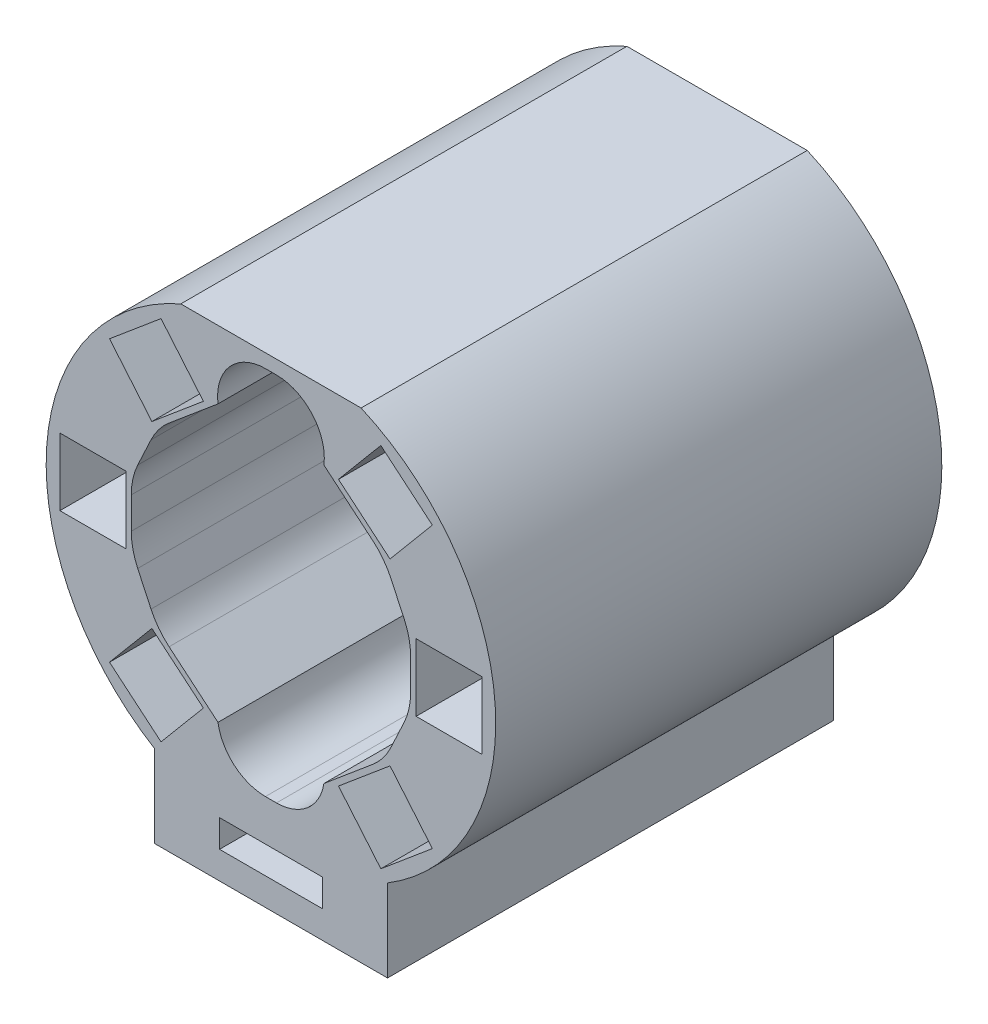
from build123d import *

# Parameters (mm, degrees)
SKETCH2_R                       = 4.79
BOSS_EXTRUDE2_DEPTH             = 65
SHELL4_START                    = 5
SHELL4_OUTLINE_R                = 4.79
SHELL4_DEPTH                    = 60
SKETCH3_W                       = 33.974254958
SKETCH3_H                       = 12
BOSS_EXTRUDE3_DEPTH             = 65
SKETCH4_W                       = 14.974254958
SKETCH4_H                       = 4
CUT_EXTRUDE1_DEPTH              = 30
BOSS_EXTRUDE4_DEPTH             = 60
CIRPATTERN2_COUNT               = 3
CIRPATTERN2_ANGLE               = 50
CIRPATTERN2_THE_OTHER_WAY_COUNT = 3
CIRPATTERN2_THE_OTHER_WAY_ANGLE = 50
SKETCH5_4_W                     = 9.6
SKETCH5_4_H                     = 9.8
CUT_EXTRUDE2_DEPTH              = 60
CIRPATTERN3_COUNT               = 2
CIRPATTERN3_ANGLE               = 50
CIRPATTERN3_THE_OTHER_WAY_COUNT = 2
CIRPATTERN3_THE_OTHER_WAY_ANGLE = 50
MIRROR1_START                   = 5
MIRROR1_DEPTH                   = 60
MIRROR1_2_DEPTH                 = 60
FILLET2_R                       = 10
FILLET6_R                       = 7


# Read off the part's stored shape, not the designer's step: Shell4, Mirror1
with BuildPart() as part:
    # Sketch2 → Boss-Extrude2 (new body)
    with BuildSketch(Plane.XY):
        with BuildLine():
            Line((13.136304655, 30), (-13.136304655, 30))
            ThreePointArc((-13.136304655, 30), (-32.678055188, 2.169610358), (-16.987127479, -28))
            Line((-16.987127479, -28), (16.987127479, -28))
            ThreePointArc((16.987127479, -28), (32.678055188, 2.169610358), (13.136304655, 30))
        make_face()
        Circle(SKETCH2_R, mode=Mode.SUBTRACT)
    extrude(amount=BOSS_EXTRUDE2_DEPTH)

    # Shell4 outline → Shell4 (cut)
    with BuildSketch(Plane.XY.offset(SHELL4_START)):
        with BuildLine():
            ThreePointArc((-12.710723819, 28), (-30.677774708, 2.106333062), (-16.418358627, -26))
            Line((-16.418358627, -26), (16.418358627, -26))
            ThreePointArc((16.418358627, -26), (30.677774708, 2.106333062), (12.710723819, 28))
            Line((12.710723819, 28), (-12.710723819, 28))
        make_face()
        Circle(SHELL4_OUTLINE_R, mode=Mode.SUBTRACT)
    extrude(amount=SHELL4_DEPTH, mode=Mode.SUBTRACT)

    # Sketch3 → Boss-Extrude3 (add)
    with BuildSketch(Plane.XY.offset(65)):
        with Locations((0, -34)):
            Rectangle(SKETCH3_W, SKETCH3_H)
    extrude(amount=-BOSS_EXTRUDE3_DEPTH)

    # Sketch4 → Cut-Extrude1 (cut)
    with BuildSketch(Plane.XY.offset(65)):
        with Locations((0, -34)):
            Rectangle(SKETCH4_W, SKETCH4_H)
    extrude(amount=-CUT_EXTRUDE1_DEPTH, mode=Mode.SUBTRACT)

    # Sketch5 → Boss-Extrude4 (add)
    with BuildSketch(Plane.XY.offset(5)):
        with BuildLine():
            Line((21.15, 0), (20.35, 0))
            Line((20.35, 0), (20.35, -7))
            Line((20.35, -7), (29.551861194, -8.5))
            ThreePointArc((29.551861194, -8.5), (30.008505534, -6.712085787), (30.357083193, -4.9))
            Line((30.357083193, -4.9), (21.15, -4.9))
            Line((21.15, -4.9), (21.15, 0))
        make_face()
        with BuildLine():
            Line((20.35, 7), (20.35, 0))
            Line((20.35, 0), (21.15, 0))
            Line((21.15, 0), (21.15, 4.9))
            Line((21.15, 4.9), (30.357083193, 4.9))
            ThreePointArc((30.357083193, 4.9), (30.008505534, 6.712085787), (29.551861194, 8.5))
            Line((29.551861194, 8.5), (20.35, 7))
        make_face()
        with BuildLine():
            Line((30.75, 0), (21.15, 0))
            Line((21.15, 0), (21.15, -4.9))
            Line((21.15, -4.9), (30.357083193, -4.9))
            ThreePointArc((30.357083193, -4.9), (30.651613401, -2.457864094), (30.75, 0))
        make_face()
        with BuildLine():
            Line((21.15, 4.9), (21.15, 0))
            Line((21.15, 0), (30.75, 0))
            ThreePointArc((30.75, 0), (30.651613401, 2.457864094), (30.357083193, 4.9))
            Line((30.357083193, 4.9), (21.15, 4.9))
        make_face()
    boss_extrude4 = extrude(amount=BOSS_EXTRUDE4_DEPTH)

    # CirPattern2: Boss-Extrude4 ×3 about axis
    cirpattern2_axis = Axis((0, 0, 0), (0, 0, -1))
    for i in range(1, CIRPATTERN2_COUNT):
        add(boss_extrude4.rotate(cirpattern2_axis, i * CIRPATTERN2_ANGLE / (CIRPATTERN2_COUNT - 1)))

    # CirPattern2 the other way: Boss-Extrude4 ×3 about axis
    cirpattern2_the_other_way_axis = Axis((0, 0, 0), (0, 0, 1))
    for i in range(1, CIRPATTERN2_THE_OTHER_WAY_COUNT):
        add(boss_extrude4.rotate(cirpattern2_the_other_way_axis, i * CIRPATTERN2_THE_OTHER_WAY_ANGLE / (CIRPATTERN2_THE_OTHER_WAY_COUNT - 1)))

    # Sketch5<4> → Cut-Extrude2 (cut)
    with BuildSketch(Plane.XY.offset(5)):
        with Locations((25.95, 0)):
            Rectangle(SKETCH5_4_W, SKETCH5_4_H)
    cut_extrude2 = extrude(amount=CUT_EXTRUDE2_DEPTH, mode=Mode.SUBTRACT)

    # CirPattern3: Cut-Extrude2 ×2 about axis
    cirpattern3_axis = Axis((0, 0, 0), (0, 0, 1))
    for i in range(1, CIRPATTERN3_COUNT):
        add(cut_extrude2.rotate(cirpattern3_axis, i * CIRPATTERN3_ANGLE / (CIRPATTERN3_COUNT - 1)), mode=Mode.SUBTRACT)

    # CirPattern3 the other way: Cut-Extrude2 ×2 about axis
    cirpattern3_the_other_way_axis = Axis((0, 0, 0), (0, 0, -1))
    for i in range(1, CIRPATTERN3_THE_OTHER_WAY_COUNT):
        add(cut_extrude2.rotate(cirpattern3_the_other_way_axis, i * CIRPATTERN3_THE_OTHER_WAY_ANGLE / (CIRPATTERN3_THE_OTHER_WAY_COUNT - 1)), mode=Mode.SUBTRACT)

    # Mirror1 outline → Mirror1 (cut)
    with BuildSketch(Plane.XY.offset(MIRROR1_START)):
        with BuildLine():
            Line((-30.357083193, 4.9), (-30.75, 4.9))
            Line((-30.75, 4.9), (-30.75, 0))
            ThreePointArc((-30.75, 0), (-30.651613401, 2.457864094), (-30.357083193, 4.9))
        make_face()
        with BuildLine():
            ThreePointArc((-30.357083193, -4.9), (-30.651613401, -2.457864094), (-30.75, 0))
            Line((-30.75, 0), (-30.75, -4.9))
            Line((-30.75, -4.9), (-30.357083193, -4.9))
        make_face()
        with BuildLine():
            Line((-23.519336769, 20.406207338), (-23.266774714, 20.105215602))
            ThreePointArc((-23.266774714, 20.105215602), (-21.585264808, 21.90065851), (-19.765620831, 23.555948998))
            Line((-19.765620831, 23.555948998), (-23.519336769, 20.406207338))
        make_face()
        with BuildLine():
            Line((-16.012101227, 26.705525913), (-19.765620831, 23.555948998))
            ThreePointArc((-19.765620831, 23.555948998), (-17.819591962, 25.060419835), (-15.759539172, 26.404534177))
            Line((-15.759539172, 26.404534177), (-16.012101227, 26.705525913))
        make_face()
        with BuildLine():
            ThreePointArc((-19.765615493, -23.555953477), (-21.585262326, -21.900660956), (-23.266774714, -20.105215602))
            Line((-23.266774714, -20.105215602), (-23.519336769, -20.406207338))
            Line((-23.519336769, -20.406207338), (-19.765615493, -23.555953477))
        make_face()
        with BuildLine():
            ThreePointArc((-16.418358627, -26), (-18.133210875, -24.834435032), (-19.765615493, -23.555953477))
            Line((-19.765615493, -23.555953477), (-16.012101227, -26.705525913))
            Line((-16.012101227, -26.705525913), (-15.420094694, -26))
            Line((-15.420094694, -26), (-16.418358627, -26))
        make_face()
    extrude(amount=MIRROR1_DEPTH, mode=Mode.SUBTRACT)

    # Mirror1 2 outline → Mirror1 2 (add)
    with BuildSketch(Plane.XY.offset(MIRROR1_START)):
        with BuildLine():
            ThreePointArc((-23.266774714, 20.105215602), (-27.868964451, 12.995511548), (-30.357083193, 4.9))
            Line((-30.357083193, 4.9), (-21.15, 4.9))
            Line((-21.15, 4.9), (-21.15, -4.9))
            Line((-21.15, -4.9), (-30.357083193, -4.9))
            ThreePointArc((-30.357083193, -4.9), (-27.868964451, -12.995511548), (-23.266774714, -20.105215602))
            Line((-23.266774714, -20.105215602), (-17.348575716, -13.052180685))
            Line((-17.348575716, -13.052180685), (-9.841340174, -19.351499259))
            Line((-9.841340174, -19.351499259), (-15.420094694, -26))
            Line((-15.420094694, -26), (-11.234208489, -26))
            Line((-11.234208489, -26), (-7.718416755, -20.088517685))
            Line((-7.718416755, -20.088517685), (-16.536726932, -12.689076868))
            Line((-16.536726932, -12.689076868), (-20.35, -4.511486385))
            Line((-20.35, -4.511486385), (-20.35, 4.511486385))
            Line((-20.35, 4.511486385), (-16.536726932, 12.689076868))
            Line((-16.536726932, 12.689076868), (-7.718416755, 20.088517685))
            Line((-7.718416755, 20.088517685), (-12.423687387, 28))
            Line((-12.423687387, 28), (-12.710723819, 28))
            ThreePointArc((-12.710723819, 28), (-14.257466342, 27.244947302), (-15.759539172, 26.404534177))
            Line((-15.759539172, 26.404534177), (-9.841340174, 19.351499259))
            Line((-9.841340174, 19.351499259), (-17.348575716, 13.052180685))
            Line((-17.348575716, 13.052180685), (-23.266774714, 20.105215602))
        make_face()
    extrude(amount=MIRROR1_2_DEPTH)

    # Fillet2
    fillet2_edges = [part.edges().sort_by_distance(p)[0] for p in [
        (20.35, 4.511486385, 35),
        (16.536726932, 12.689076868, 35),
        (-20.35, -4.511486385, 35),
        (-16.536726932, -12.689076868, 35),
        (-20.35, 4.511486385, 35),
        (-16.536726932, 12.689076868, 35),
        (20.35, -4.511486385, 35),
        (16.536726932, -12.689076868, 35),
    ]]
    fillet(fillet2_edges, radius=FILLET2_R)

    # Fillet6
    # the kernel refuses this fillet: 7 mm, written as the material it adds along each edge
    with BuildSketch(Plane(origin=(12.423687387, 28, 5), x_dir=(-0.5111673704735938, -0.8594811919775275, 0), z_dir=(0, 0, 1))) as fillet6_piece_1:
        with BuildLine():
            CenterArc((11.96925694, -6.431066244), FILLET6_R, 113.259789789, 97.48182924)
            Line((5.952888596, -10.009237838), (5.832561229, -10.08080127))
            Line((5.832561229, -10.08080127), (-0.120327367, -0.071563432))
            Line((-0.120327367, -0.071563432), (0, 0.14))
            ThreePointArc((0, 0.14), (4.602475533, 0.14), (9.149664949, 0.128621325))
            Line((9.149664949, 0.128621325), (9.204951066, 0))
        make_face()
    extrude(amount=60)
    with BuildSketch(Plane(origin=(-11.234208489, -26, 5), x_dir=(1, 0, 0), z_dir=(0, 0, 1))) as fillet6_piece_2:
        with BuildLine():
            CenterArc((10.430640196, 7), FILLET6_R, 188.945942292, 81.054057708)
            Line((3.515791734, 5.911482315), (3.377494765, 5.889711961))
            ThreePointArc((3.377494765, 5.889711961), (1.6375685, 3.027304589), (-0.120327367, 0.071563432))
            Line((-0.120327367, 0.071563432), (0, -0.14))
            Line((0, -0.14), (10.430640196, -0.14))
            Line((10.430640196, -0.14), (10.430640196, 0))
        make_face()
    extrude(amount=60)
    with BuildSketch(Plane(origin=(-12.423687387, 28, 5), x_dir=(1, 0, 0), z_dir=(0, 0, 1))) as fillet6_piece_3:
        with BuildLine():
            CenterArc((11.645674078, -7), FILLET6_R, 90, 97.481829242)
            Line((4.705270632, -7.911482315), (4.566462563, -7.929711961))
            ThreePointArc((4.566462563, -7.929711961), (2.232307949, -4.027304589), (-0.120327367, -0.071563432))
            Line((-0.120327367, -0.071563432), (0, 0.14))
            Line((0, 0.14), (11.645674078, 0.14))
            Line((11.645674078, 0.14), (11.645674078, 0))
        make_face()
    extrude(amount=60)
    with BuildSketch(Plane(origin=(11.234208489, -26, 65), x_dir=(-0.5111673704735934, 0.8594811919775279, 0), z_dir=(0, 0, -1))) as fillet6_piece_4:
        with BuildLine():
            CenterArc((11.348171265, -5.386767475), FILLET6_R, 129.687561323, 81.054057706)
            Line((5.331802921, -8.964939069), (5.211475554, -9.036502501))
            Line((5.211475554, -9.036502501), (-0.120327367, -0.071563432))
            Line((-0.120327367, -0.071563432), (0, 0.14))
            ThreePointArc((0, 0.14), (3.438982941, 0.14), (6.788561774, 0.10773535))
            Line((6.788561774, 0.10773535), (6.877965882, 0))
        make_face()
    extrude(amount=60)


solid = part.part
